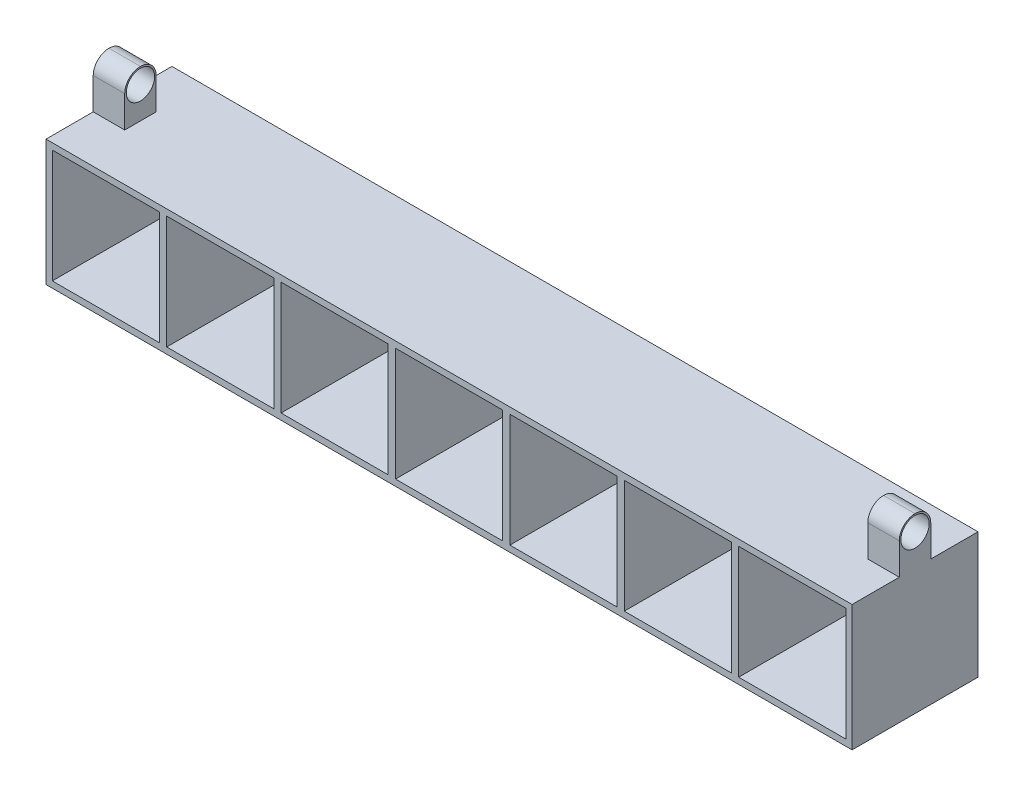
from build123d import *

# Parameters (mm, degrees)
SKETCH1_W               = 2560
SKETCH1_H               = 400
BOSS_EXTRUDE1_DEPTH     = 400
SKETCH2_W               = 340
SKETCH2_H               = 360
CUT_EXTRUDE1_DEPTH      = 380
SKETCH3_W               = 100
SKETCH3_H               = 100
BOSS_EXTRUDE2_DEPTH     = 150
FILLET1_R               = 50
SKETCH4_W               = 100
SKETCH4_H               = 100
BOSS_EXTRUDE3_DEPTH     = 150
FILLET2_R               = 50
CUT_EXTRUDE2_DEPTH      = 2622.755137308
CUT_EXTRUDE2_DEPTH_BACK = 2622.755137308
SKETCH5_R               = 45


with BuildPart() as part:
    # Sketch1 → Boss-Extrude1 (new body)
    with BuildSketch(Plane.XY):
        with Locations((1280, -200)):
            Rectangle(SKETCH1_W, SKETCH1_H)
    extrude(amount=BOSS_EXTRUDE1_DEPTH)

    # Sketch2 → Cut-Extrude1 (cut)
    with BuildSketch(Plane.XY.offset(400)):
        with Locations((190, -200)):
            Rectangle(SKETCH2_W, SKETCH2_H)
        with Locations((553.333333333, -200)):
            Rectangle(SKETCH2_W, SKETCH2_H)
        with Locations((916.666666667, -200)):
            Rectangle(SKETCH2_W, SKETCH2_H)
        with Locations((1280, -200)):
            Rectangle(SKETCH2_W, SKETCH2_H)
        with Locations((1643.333333333, -200)):
            Rectangle(SKETCH2_W, SKETCH2_H)
        with Locations((2006.666666667, -200)):
            Rectangle(SKETCH2_W, SKETCH2_H)
        with Locations((2370, -200)):
            Rectangle(SKETCH2_W, SKETCH2_H)
    extrude(amount=-CUT_EXTRUDE1_DEPTH, mode=Mode.SUBTRACT)

    # Sketch3 → Boss-Extrude2 (add)
    with BuildSketch(Plane(origin=(0, 0, 0), x_dir=(1, 0, 0), z_dir=(0, 1, 0))):
        with Locations((50, -200)):
            Rectangle(SKETCH3_W, SKETCH3_H)
    extrude(amount=BOSS_EXTRUDE2_DEPTH)

    # Fillet1
    fillet1_edges = [part.edges().sort_by_distance(p)[0] for p in [
        (50, 150, 150),
        (50, 150, 250),
    ]]
    fillet(fillet1_edges, radius=FILLET1_R - 0.0001)  # a hair under: the kernel refuses the full size

    # Sketch4 → Boss-Extrude3 (add)
    with BuildSketch(Plane(origin=(0, 0, 0), x_dir=(1, 0, 0), z_dir=(0, 1, 0))):
        with Locations((2510, -200)):
            Rectangle(SKETCH4_W, SKETCH4_H)
    extrude(amount=BOSS_EXTRUDE3_DEPTH)

    # Fillet2
    fillet2_edges = [part.edges().sort_by_distance(p)[0] for p in [
        (2510, 150, 150),
        (2510, 150, 250),
    ]]
    fillet(fillet2_edges, radius=FILLET2_R - 0.0001)  # a hair under: the kernel refuses the full size

    # Sketch5 → Cut-Extrude2 (cut, two sides: drawn at the far end of the back side and taken through both)
    with BuildSketch(Plane(origin=(2560, 0, 0), x_dir=(0, 0, -1), z_dir=(1, 0, 0)).offset(-CUT_EXTRUDE2_DEPTH_BACK)):
        with Locations((-200, 100)):
            Circle(SKETCH5_R)
    extrude(amount=CUT_EXTRUDE2_DEPTH + CUT_EXTRUDE2_DEPTH_BACK, mode=Mode.SUBTRACT)


solid = part.part
